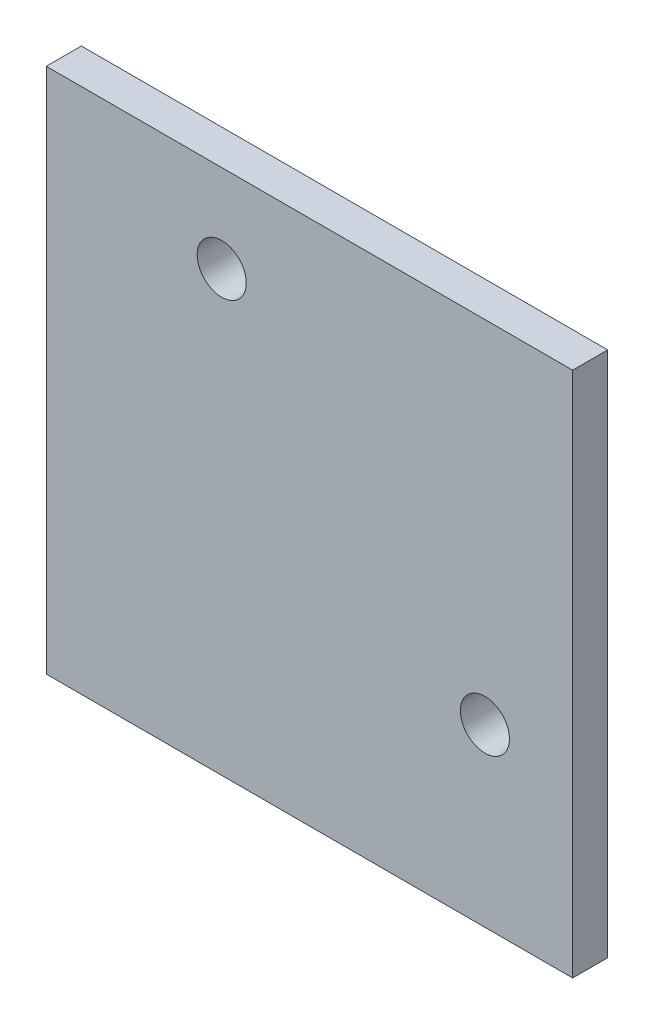
from build123d import *

# Parameters (mm, degrees)
SKETCH_1_W             = 150
SKETCH_1_H             = 150
SM_BASE_FLANGE_1_DEPTH = 10
SKETCH_3_R             = 7
CUT_EXTRUDE_1_DEPTH    = 10


# Sheet-metal steps are written as plain solids
with BuildPart() as part:
    # Sketch 1 → Базовая кромка1 (new body)
    with BuildSketch(Plane.XY):
        with Locations((75, -75)):
            Rectangle(SKETCH_1_W, SKETCH_1_H)
    extrude(amount=-SM_BASE_FLANGE_1_DEPTH)

    # Эскиз3 → Вырез-Вытянуть1 (cut)
    with BuildSketch(Plane(origin=(0, 0, -10), x_dir=(-1, 0, 0), z_dir=(0, 0, -1))):
        with Locations((-125, -100)):
            Circle(SKETCH_3_R)
        with Locations((-50, -25)):
            Circle(SKETCH_3_R)
    extrude(amount=-CUT_EXTRUDE_1_DEPTH, mode=Mode.SUBTRACT)


solid = part.part
